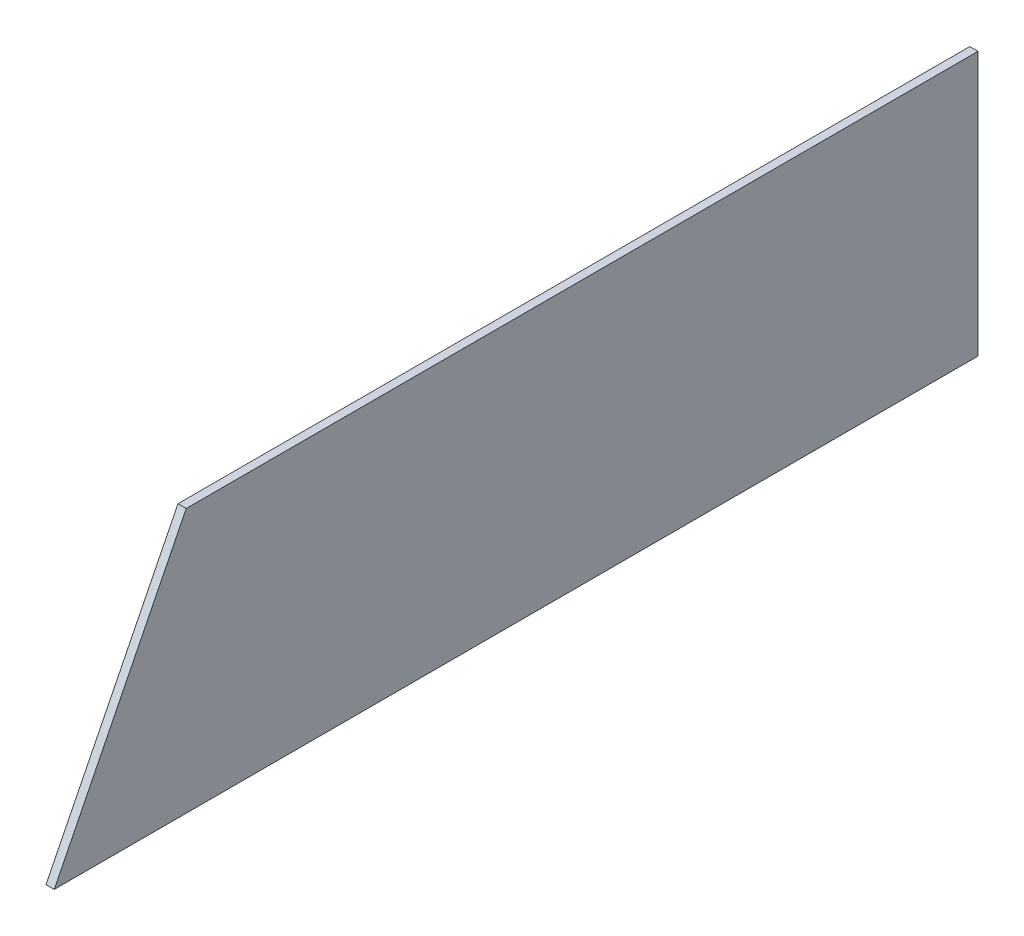
from build123d import *

# Parameters (mm, degrees)
SKETCH1_W               = 355.6
SKETCH1_H               = 101.6
BOSS_EXTRUDE1_DEPTH     = 3.175
CUT_EXTRUDE1_DEPTH      = 185.942046666
CUT_EXTRUDE1_DEPTH_BACK = 3.175


with BuildPart() as part:
    # Sketch1 → Boss-Extrude1 (new body)
    with BuildSketch(Plane(origin=(0, 0, 0), x_dir=(0, 0, -1), z_dir=(1, 0, 0))):
        Rectangle(SKETCH1_W, SKETCH1_H)
    extrude(amount=BOSS_EXTRUDE1_DEPTH)

    # Sketch2 → Cut-Extrude1 (cut, two sides: drawn at the far end of the back side and taken through both)
    with BuildSketch(Plane(origin=(3.175, 0, 0), x_dir=(0, 0, -1), z_dir=(1, 0, 0)).offset(-CUT_EXTRUDE1_DEPTH_BACK)):
        Polygon((-513.057770468, -721.315540935), (-177.8, -50.8), (-127, 50.8), (208.257770468, 721.315540935), (-1132.773311403, 1391.831081871), (-1854.088852339, -50.8), align=None)
    extrude(amount=CUT_EXTRUDE1_DEPTH + CUT_EXTRUDE1_DEPTH_BACK, mode=Mode.SUBTRACT)


solid = part.part
